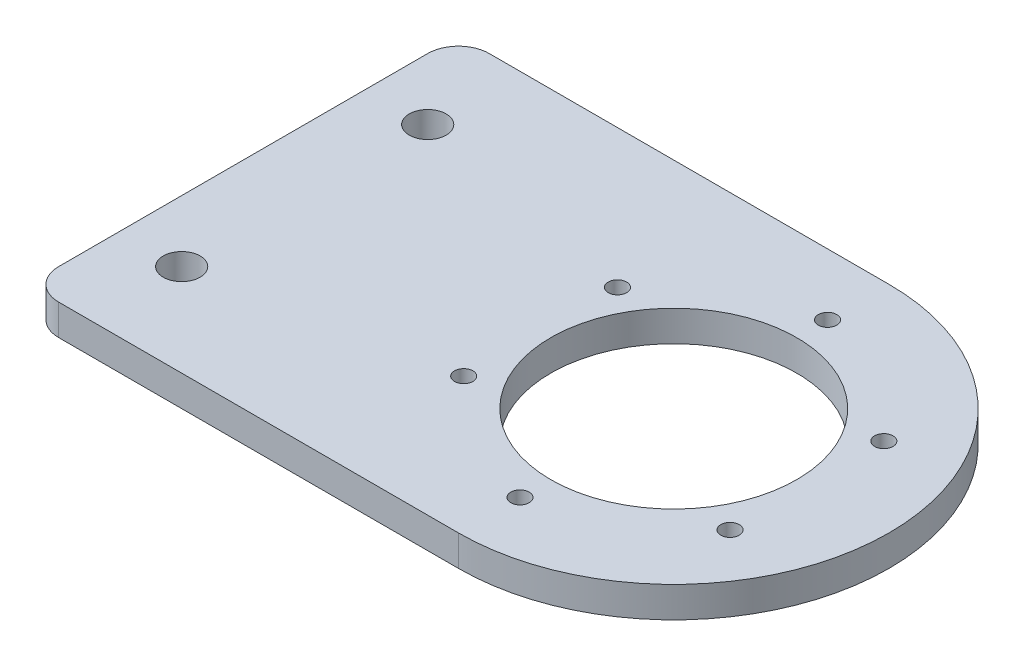
from build123d import *

# Parameters (mm, degrees)
SKETCH1_R           = 1.5
SKETCH1_R_2         = 20
SKETCH1_R_3         = 3
BOSS_EXTRUDE1_DEPTH = 5
FILLET1_R           = 5


with BuildPart() as part:
    # Sketch1 → Boss-Extrude1 (new body)
    with BuildSketch(Plane(origin=(0, 0, 0), x_dir=(1, 0, 0), z_dir=(0, 1, 0))):
        with BuildLine():
            Line((-70, 35), (0, 35))
            ThreePointArc((0, 35), (35, 0), (0, -35))
            Line((0, -35), (-70, -35))
            Line((-70, -35), (-70, 35))
        make_face()
        with Locations((0, 25)):
            Circle(SKETCH1_R, mode=Mode.SUBTRACT)
        with Locations((21.650635095, 12.5)):
            Circle(SKETCH1_R, mode=Mode.SUBTRACT)
        with Locations((21.650635095, -12.5)):
            Circle(SKETCH1_R, mode=Mode.SUBTRACT)
        with Locations((0, -25)):
            Circle(SKETCH1_R, mode=Mode.SUBTRACT)
        with Locations((-21.650635095, -12.5)):
            Circle(SKETCH1_R, mode=Mode.SUBTRACT)
        with Locations((-21.650635095, 12.5)):
            Circle(SKETCH1_R, mode=Mode.SUBTRACT)
        Circle(SKETCH1_R_2, mode=Mode.SUBTRACT)
        with Locations((-60, 20)):
            Circle(SKETCH1_R_3, mode=Mode.SUBTRACT)
        with Locations((-60, -20)):
            Circle(SKETCH1_R_3, mode=Mode.SUBTRACT)
    extrude(amount=BOSS_EXTRUDE1_DEPTH)

    # Fillet1
    fillet1_edges = [part.edges().sort_by_distance(p)[0] for p in [
        (-70, 2.5, -35),
        (-70, 2.5, 35),
    ]]
    fillet(fillet1_edges, radius=FILLET1_R)


solid = part.part
